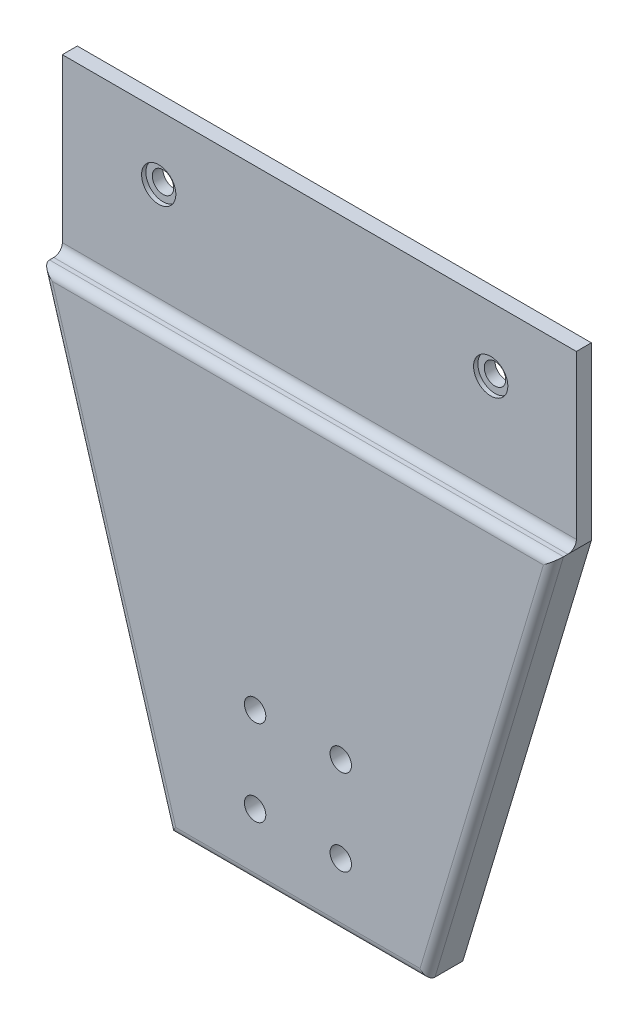
from build123d import *

# Parameters (mm, degrees)
BOSS_EXTRUDE1_DEPTH = 10.795
SKETCH2_W           = 152.4
SKETCH2_H           = 4.445
BOSS_EXTRUDE2_DEPTH = 50.8
SKETCH3_R           = 3.175
CUT_EXTRUDE1_DEPTH  = 495.317625141
FILLET1_R           = 2.54
FILLET2_R           = 2.54
SKETCH4_R           = 5.08
CUT_EXTRUDE2_DEPTH  = 1.27


with BuildPart() as part:
    # Sketch1 → Boss-Extrude1 (new body)
    with BuildSketch(Plane.XY):
        Polygon((228.6, -311.15), (190.5, -438.15), (114.3, -438.15), (76.2, -311.15), align=None)
    extrude(amount=-BOSS_EXTRUDE1_DEPTH)

    # Sketch2 → Boss-Extrude2 (add)
    with BuildSketch(Plane(origin=(0, -311.15, 0), x_dir=(1, 0, 0), z_dir=(0, 1, 0))):
        with Locations((152.4, 8.5725)):
            Rectangle(SKETCH2_W, SKETCH2_H)
    extrude(amount=BOSS_EXTRUDE2_DEPTH)

    # Sketch3 → Cut-Extrude1 (cut, through all)
    with BuildSketch(Plane(origin=(0, 0, -10.795), x_dir=(-1, 0, 0), z_dir=(0, 0, -1))):
        with Locations((-104.775, -279.4)):
            Circle(SKETCH3_R)
        with Locations((-203.2, -279.4)):
            Circle(SKETCH3_R)
        with Locations((-139.7, -393.7)):
            Circle(SKETCH3_R)
        with Locations((-165.1, -393.7)):
            Circle(SKETCH3_R)
        with Locations((-139.7, -419.1)):
            Circle(SKETCH3_R)
        with Locations((-165.1, -419.1)):
            Circle(SKETCH3_R)
    extrude(amount=-CUT_EXTRUDE1_DEPTH, mode=Mode.SUBTRACT)

    # Fillet1
    fillet1_edges = [part.edges().sort_by_distance(p)[0] for p in [
        (152.4, -311.15, -6.35),
    ]]
    fillet(fillet1_edges, radius=FILLET1_R)

    # Fillet2
    fillet2_edges = [part.edges().sort_by_distance(p)[0] for p in [
        (152.4, -438.15, 0),
        (95.25, -374.65, 0),
        (152.4, -311.15, 0),
        (209.55, -374.65, 0),
    ]]
    fillet(fillet2_edges, radius=FILLET2_R)

    # Sketch4 → Cut-Extrude2 (cut)
    with BuildSketch(Plane.XY.offset(-6.35)):
        with Locations((104.775, -279.4)):
            Circle(SKETCH4_R)
        with Locations((203.2, -279.4)):
            Circle(SKETCH4_R)
    extrude(amount=-CUT_EXTRUDE2_DEPTH, mode=Mode.SUBTRACT)


solid = part.part
